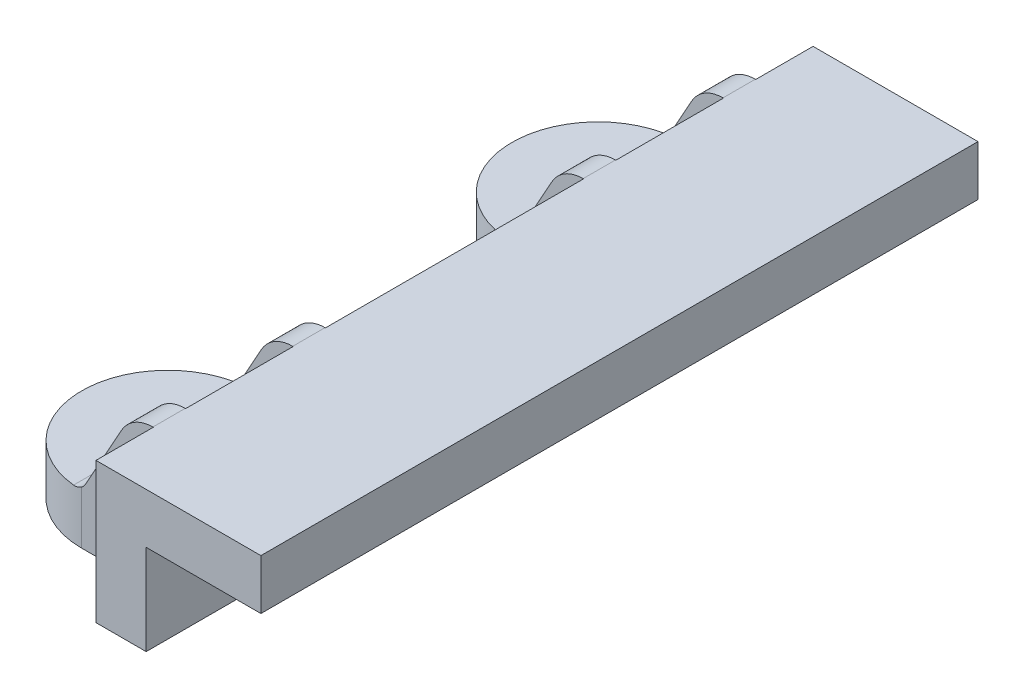
from build123d import *

# Parameters (mm, degrees)
SALIENTE_EXTRUIR1_DEPTH  = 25
CROQUIS2_R               = 2.25
SALIENTE_EXTRUIR2_DEPTH  = 3.5
SALIENTE_EXTRUIR3_DEPTH  = 2.25
REDONDEO3_R              = 1
REDONDEO5_R              = 2.5
REDONDEO3_OF_SIMETR_A1_R = 1
REDONDEO5_OF_SIMETR_A1_R = 2.5
REDONDEO3_OF_SIMETR_A4_R = 1
REDONDEO5_OF_SIMETR_A4_R = 2.5
SALIENTE_EXTRUIR4_DEPTH  = 2.25
REDONDEO6_R              = 2.5
REDONDEO7_R              = 1


with BuildPart() as part:
    # Croquis1 → Saliente-Extruir1 (new, symmetric)
    with BuildSketch(Plane.XY):
        Polygon((0, 0), (0, 9.8), (11.5, 9.8), (11.5, 6.3), (3.5, 6.3), (3.5, 0), align=None)
    extrude(amount=SALIENTE_EXTRUIR1_DEPTH, both=True)

    # Croquis2 → Saliente-Extruir2 (add)
    with BuildSketch(Plane(origin=(0, 0, 0), x_dir=(1, 0, 0), z_dir=(0, 1, 0))):
        with BuildLine():
            Line((0, 9), (-5, 9))
            ThreePointArc((-5, 9), (-11, 15), (-5, 21))
            Line((-5, 21), (0, 21))
            Line((0, 21), (0, 9))
        make_face()
        with Locations((-5, 15)):
            Circle(CROQUIS2_R, mode=Mode.SUBTRACT)
    saliente_extruir2 = extrude(amount=SALIENTE_EXTRUIR2_DEPTH)

    # Croquis3 → Saliente-Extruir3 (add)
    with BuildSketch(Plane.XY.offset(-9)):
        Polygon((0, 9.8), (0, 3.5), (-5, 3.5), (-1.5, 9.8), align=None)
    saliente_extruir3 = extrude(amount=-SALIENTE_EXTRUIR3_DEPTH)

    # Redondeo3
    redondeo3_edges = [part.edges().sort_by_distance(p)[0] for p in [
        (-5, 3.5, -10.125),
    ]]
    fillet(redondeo3_edges, radius=REDONDEO3_R)

    # Redondeo5
    redondeo5_edges = [part.edges().sort_by_distance(p)[0] for p in [
        (-1.5, 9.8, -10.125),
    ]]
    fillet(redondeo5_edges, radius=REDONDEO5_R)

    # Simetría1: Saliente-Extruir3 across plane
    add(saliente_extruir3.mirror(Plane(origin=(0, 0, -15), x_dir=(1, 0, 0), z_dir=(0, 0, -1))))

    # Redondeo3 of Simetría1
    redondeo3_of_simetr_a1_edges = [part.edges().sort_by_distance(p)[0] for p in [
        (-5, 3.5, -19.875),
    ]]
    fillet(redondeo3_of_simetr_a1_edges, radius=REDONDEO3_OF_SIMETR_A1_R)

    # Redondeo5 of Simetría1
    redondeo5_of_simetr_a1_edges = [part.edges().sort_by_distance(p)[0] for p in [
        (-1.5, 9.8, -19.875),
    ]]
    fillet(redondeo5_of_simetr_a1_edges, radius=REDONDEO5_OF_SIMETR_A1_R)

    # Simetría4: Saliente-Extruir2, Saliente-Extruir3 across plane
    add(saliente_extruir2.mirror(Plane.XY))
    add(saliente_extruir3.mirror(Plane.XY))

    # Redondeo3 of Simetría4
    redondeo3_of_simetr_a4_edges = [part.edges().sort_by_distance(p)[0] for p in [
        (-5, 3.5, 10.125),
    ]]
    fillet(redondeo3_of_simetr_a4_edges, radius=REDONDEO3_OF_SIMETR_A4_R)

    # Redondeo5 of Simetría4
    redondeo5_of_simetr_a4_edges = [part.edges().sort_by_distance(p)[0] for p in [
        (-1.5, 9.8, 10.125),
    ]]
    fillet(redondeo5_of_simetr_a4_edges, radius=REDONDEO5_OF_SIMETR_A4_R)

    # Croquis4 → Saliente-Extruir4 (add)
    with BuildSketch(Plane.XY.offset(21)):
        Polygon((0, 3.5), (-5, 3.5), (-1.5, 9.8), (0, 9.8), align=None)
    extrude(amount=-SALIENTE_EXTRUIR4_DEPTH)

    # Redondeo6
    redondeo6_edges = [part.edges().sort_by_distance(p)[0] for p in [
        (-1.5, 9.8, 19.875),
    ]]
    fillet(redondeo6_edges, radius=REDONDEO6_R)

    # Redondeo7
    redondeo7_edges = [part.edges().sort_by_distance(p)[0] for p in [
        (-5, 3.5, 19.875),
    ]]
    fillet(redondeo7_edges, radius=REDONDEO7_R)


solid = part.part
